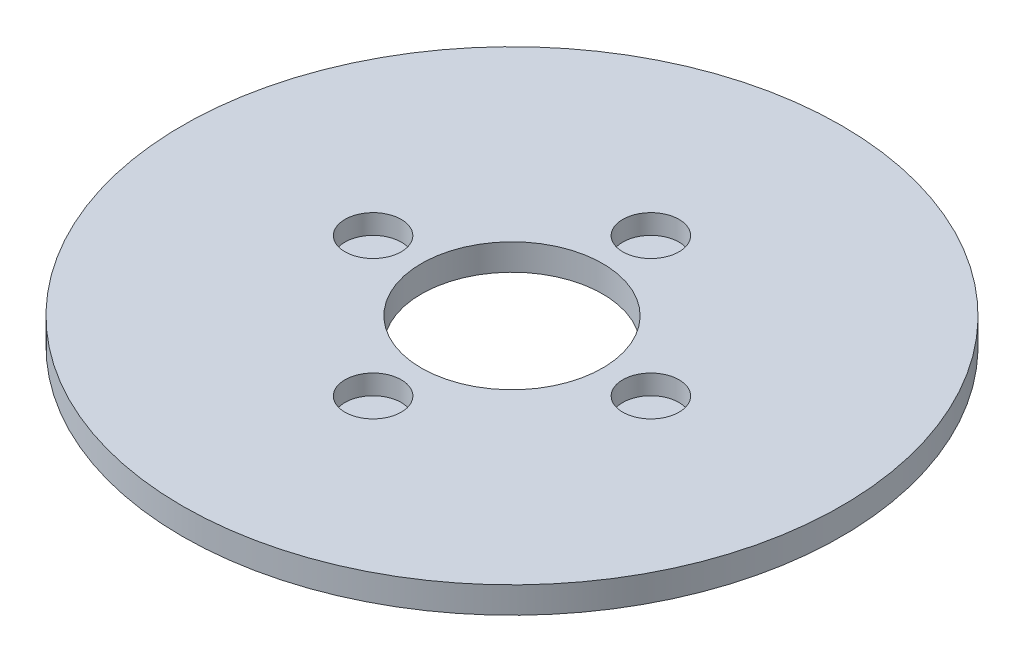
from build123d import *

# Parameters (mm, degrees)
SKETCH1_R           = 100
BOSS_EXTRUDE1_DEPTH = 8
SKETCH2_R           = 27.5
CUT_EXTRUDE1_DEPTH  = 142.647449677
SKETCH3_R           = 8.53570797
CUT_EXTRUDE2_DEPTH  = 5.977523803
CIRPATTERN1_COUNT   = 4


with BuildPart() as part:
    # Sketch1 → Boss-Extrude1 (new body)
    with BuildSketch(Plane(origin=(0, 0, 0), x_dir=(1, 0, 0), z_dir=(0, 1, 0))):
        Circle(SKETCH1_R)
    extrude(amount=BOSS_EXTRUDE1_DEPTH)

    # Sketch2 → Cut-Extrude1 (cut, through all)
    with BuildSketch(Plane(origin=(0, 0, 0), x_dir=(1, 0, 0), z_dir=(0, 1, 0))):
        Circle(SKETCH2_R)
    extrude(amount=CUT_EXTRUDE1_DEPTH, mode=Mode.SUBTRACT)

    # Sketch3 → Cut-Extrude2 (cut)
    with BuildSketch(Plane(origin=(0, 8, 0), x_dir=(1, 0, 0), z_dir=(0, 1, 0))):
        with Locations((-42.147120742, 0)):
            Circle(SKETCH3_R)
    cut_extrude2 = extrude(amount=-CUT_EXTRUDE2_DEPTH, mode=Mode.SUBTRACT)

    # CirPattern1: Cut-Extrude2 ×4 about axis
    cirpattern1_axis = Axis((0, 0, 0), (0, 1, 0))
    for i in range(1, CIRPATTERN1_COUNT):
        add(cut_extrude2.rotate(cirpattern1_axis, i * 360 / CIRPATTERN1_COUNT), mode=Mode.SUBTRACT)


solid = part.part
